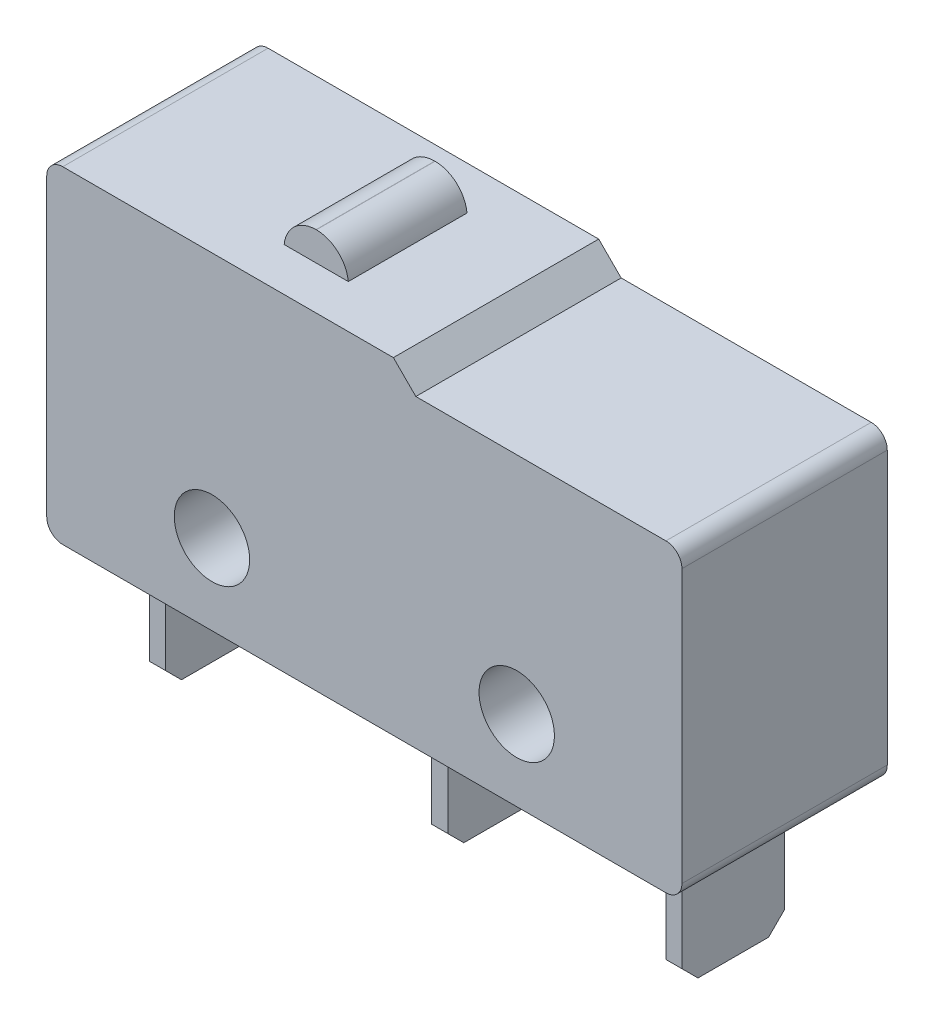
from build123d import *

# Parameters (mm, degrees)
SKETCH_1_W               = 19.8
SKETCH_1_H               = 10.2
EXTRUDE_1_DEPTH          = 6.4
CUT_EXTRUDE_1_DEPTH      = 13.844454056
CUT_EXTRUDE_1_DEPTH_BACK = 13.844454056
SKETCH_3_R               = 1.175
CUT_EXTRUDE_2_DEPTH      = 13.844454056
SKETCH_4_W               = 2
SKETCH_4_H               = 3.7
EXTRUDE_2_DEPTH          = 0.9
FILLET_2_R               = 0.5
FILLET_3_R               = 1
SKETCH_6_W               = 0.5
SKETCH_6_H               = 3.2
EXTRUDE_3_DEPTH          = 3.9
CHAMFER_1_SIZE           = 0.5


with BuildPart() as part:
    # 草图1 → 凸台-拉伸1 (new body)
    with BuildSketch(Plane.XY):
        Rectangle(SKETCH_1_W, SKETCH_1_H)
    extrude(amount=EXTRUDE_1_DEPTH)

    # 草图2 → 切除-拉伸1 (cut, two sides: drawn at the far end of the back side and taken through both)
    with BuildSketch(Plane.XY.offset(6.4).offset(-CUT_EXTRUDE_1_DEPTH_BACK)):
        Polygon((9.9, 5.1), (0.905266145, 5.1), (1.605266145, 4.4), (9.9, 4.4), align=None)
    extrude(amount=CUT_EXTRUDE_1_DEPTH + CUT_EXTRUDE_1_DEPTH_BACK, mode=Mode.SUBTRACT)

    # 草图3 → 切除-拉伸2 (cut, through all)
    with BuildSketch(Plane.XY.offset(6.4)):
        with Locations((-4.75, -2.6)):
            Circle(SKETCH_3_R)
        with Locations((4.75, -2.6)):
            Circle(SKETCH_3_R)
    extrude(amount=-CUT_EXTRUDE_2_DEPTH, mode=Mode.SUBTRACT)

    # 草图4 → 凸台-拉伸2 (add)
    with BuildSketch(Plane(origin=(0, 5.1, 0), x_dir=(1, 0, 0), z_dir=(0, 1, 0))):
        with Locations((-2.85, -3.2)):
            Rectangle(SKETCH_4_W, SKETCH_4_H)
    extrude(amount=EXTRUDE_2_DEPTH)

    # 圆角2
    fillet_2_edges = [part.edges().sort_by_distance(p)[0] for p in [
        (9.9, 4.4, 3.2),
        (-9.9, 5.1, 3.2),
        (9.9, -5.1, 3.2),
        (-9.9, -5.1, 3.2),
    ]]
    fillet(fillet_2_edges, radius=FILLET_2_R)

    # 圆角3
    # the kernel refuses this fillet: 1 mm, written as the material it takes off along each edge
    with BuildSketch(Plane(origin=(-1.85, 6, -1.137468593), x_dir=(0, -1, 0), z_dir=(0, 0, 1)), Plane(origin=(-3.85, 6, 7.537468593), x_dir=(0, -1, 0), z_dir=(0, 0, -1))) as fillet_3_piece_1:
        with BuildLine():
            CenterArc((1, -0.994987437), FILLET_3_R, 95.739170477, 84.260829523)
            Line((0, -0.994987437), (-0.02, -0.994987437))
            Line((-0.02, -0.994987437), (-0.02, 0))
            Line((-0.02, 0), (0, 0.02))
            ThreePointArc((0, 0.02), (0.45, 0.02), (0.898, 0.019899749))
            Line((0.898, 0.019899749), (0.9, 0))
        make_face()
    extrude(amount=8.674937186, mode=Mode.SUBTRACT)

    # 草图6 → 凸台-拉伸3 (add)
    with BuildSketch(Plane.XZ.offset(5.1)):
        with Locations((-8.05, 3.2)):
            Rectangle(SKETCH_6_W, SKETCH_6_H)
        with Locations((0.75, 3.2)):
            Rectangle(SKETCH_6_W, SKETCH_6_H)
        with Locations((8.05, 3.2)):
            Rectangle(SKETCH_6_W, SKETCH_6_H)
    extrude(amount=EXTRUDE_3_DEPTH)

    # 倒角1
    chamfer_1_edges = [part.edges().sort_by_distance(p)[0] for p in [
        (0.75, -9, 4.8),
        (0.75, -9, 1.6),
        (8.05, -9, 4.8),
        (8.05, -9, 1.6),
        (-8.05, -9, 4.8),
        (-8.05, -9, 1.6),
    ]]
    chamfer(chamfer_1_edges, length=CHAMFER_1_SIZE)


solid = part.part
